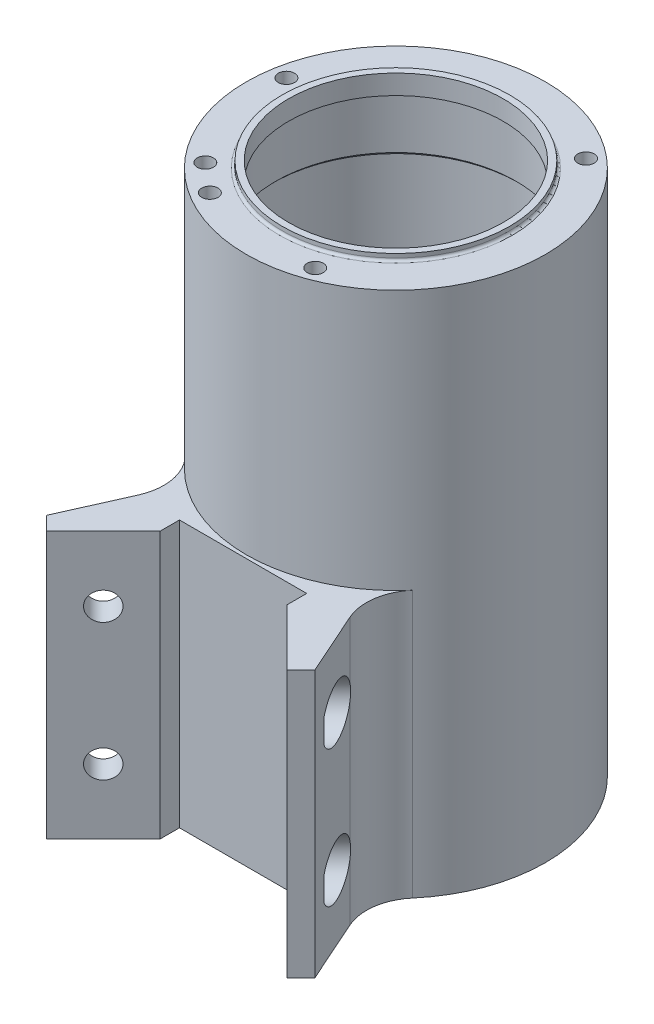
from build123d import *

# Parameters (mm, degrees)
BOSS_EXTRUDE1_START           = -40
BOSS_EXTRUDE1_DEPTH           = 41
SKETCH7_W                     = 1.6
SKETCH7_H                     = 83.5
M3_CLEARANCE_HOLE1_AT_2_COUNT = 2
M3_CLEARANCE_HOLE1_AT_2_PITCH = 20.75
M3_CLEARANCE_HOLE1_AT_3_COUNT = 2
M3_CLEARANCE_HOLE1_AT_3_PITCH = 35.940054257
M3_CLEARANCE_HOLE1_AT_4_COUNT = 2
M3_CLEARANCE_HOLE1_AT_4_PITCH = 41.5
M3_CLEARANCE_HOLE1_AT_5_COUNT = 2
M3_CLEARANCE_HOLE1_AT_5_PITCH = 35.940054257
M3_CLEARANCE_HOLE1_AT_6_COUNT = 2
M3_CLEARANCE_HOLE1_AT_6_PITCH = 20.75
M3_TAPPED_HOLE2_AT_2_COUNT    = 2
M3_TAPPED_HOLE2_AT_2_PITCH    = 20.75
M3_TAPPED_HOLE2_AT_3_COUNT    = 2
M3_TAPPED_HOLE2_AT_3_PITCH    = 35.940054257
M3_TAPPED_HOLE2_AT_4_COUNT    = 2
M3_TAPPED_HOLE2_AT_4_PITCH    = 41.5
M3_TAPPED_HOLE2_AT_5_COUNT    = 2
M3_TAPPED_HOLE2_AT_5_PITCH    = 35.940054257
M3_TAPPED_HOLE2_AT_6_COUNT    = 2
M3_TAPPED_HOLE2_AT_6_PITCH    = 20.75
M3_TAPPED_HOLE1_AT_2_COUNT    = 2
M3_TAPPED_HOLE1_AT_2_PITCH    = 35.940054257
M3_TAPPED_HOLE1_AT_3_COUNT    = 2
M3_TAPPED_HOLE1_AT_3_PITCH    = 35.940054257
M3_TAPPED_HOLE1_AT_4_COUNT    = 2
M3_TAPPED_HOLE1_AT_4_PITCH    = 41.401555851
M3_TAPPED_HOLE1_AT_5_COUNT    = 2
M3_TAPPED_HOLE1_AT_5_PITCH    = 41.401555851
FILLET1_R                     = 8
BOSS_EXTRUDE2_START           = 1
SKETCH18_R                    = 17.5
SKETCH18_R_2                  = 16.5
BOSS_EXTRUDE2_DEPTH           = 1
ADVANCEDHOLE1_START           = -7.819805153
ADVANCEDHOLE1_DEPTH           = 2.897488682
ADVANCEDHOLE1_START_2         = -11.819805153
ADVANCEDHOLE1_2_OUTLINE_R     = 2.15
ADVANCEDHOLE1_2_DEPTH         = 4
ADVANCEDHOLE2_START           = 4.922316471
ADVANCEDHOLE2_DEPTH           = 2.897488682
ADVANCEDHOLE2_START_2         = 7.819805153
ADVANCEDHOLE2_2_OUTLINE_R     = 2.15
ADVANCEDHOLE2_2_DEPTH         = 4
FILLET2_R                     = 0.4
FILLET4_R                     = 0.15
CHAMFER1_SIZE                 = 0.5
CHAMFER2_SIZE                 = 0.6
FILLET5_R                     = 0.4


with BuildPart() as part:
    # Sketch2 → Revolve1 (revolve)
    with BuildSketch(Plane(origin=(0, 0, 0), x_dir=(0, 0, -1), z_dir=(1, 0, 0)), mode=Mode.PRIVATE) as revolve1_sk:
        Polygon((18.5, -83.5), (18.5, -74.5), (19, -74.5), (19, -14.5), (18.5, -14.5), (18.5, -5.5), (16.5, -5.5), (16.5, -3.5), (23, -3.5), (23, -84.5), (18.5, -84.5), align=None)
    revolve(revolve1_sk.sketch.rotate(Axis((0, 55, 0), (0, -1, 0)), 180), axis=Axis((0, 55, 0), (0, -1, 0)))

    # Sketch3 → Boss-Extrude1 (add, through all)
    with BuildSketch(Plane(origin=(0, -3.5, 0), x_dir=(1, 0, 0), z_dir=(0, 1, 0)).offset(BOSS_EXTRUDE1_START)):
        with BuildLine():
            Line((-18.5, -35.215728753), (-20.621320344, -33.094408409))
            Line((-20.621320344, -33.094408409), (-14, -18.248287591))
            ThreePointArc((-14, -18.248287591), (0, -23), (14, -18.248287591))
            Line((14, -18.248287591), (20.621320344, -33.094408409))
            Line((20.621320344, -33.094408409), (18.5, -35.215728753))
            Line((18.5, -35.215728753), (9.784271247, -26.5))
            Line((9.784271247, -26.5), (9.784271247, -23.5))
            Line((9.784271247, -23.5), (-9.784271247, -23.5))
            Line((-9.784271247, -23.5), (-9.784271247, -26.5))
            Line((-9.784271247, -26.5), (-18.5, -35.215728753))
        make_face()
    extrude(amount=-BOSS_EXTRUDE1_DEPTH)

    # Sketch10 → M3 Tapped Hole2 (revolve, cut)
    with BuildSketch(Plane(origin=(0, -84.5, -20.75), x_dir=(0, 0, -1), z_dir=(1, 0, 0))):
        Polygon((0, 0), (0, 9.251075774), (1.25, 8.5), (1.25, 0), align=None)
    m3_tapped_hole2 = revolve(axis=Axis((0, -90.85, -20.75), (0, 1, 0)), mode=Mode.SUBTRACT)

    # M3 Tapped Hole2 at 2: M3 Tapped Hole2 ×2
    with Locations(*[Vector(-0.8660254037844387, 0, 0.4999999999999999) * (i * M3_TAPPED_HOLE2_AT_2_PITCH) for i in range(1, M3_TAPPED_HOLE2_AT_2_COUNT)]):
        add(m3_tapped_hole2, mode=Mode.SUBTRACT)

    # M3 Tapped Hole2 at 3: M3 Tapped Hole2 ×2
    with Locations(*[Vector(-0.5000000000000002, 0, 0.8660254037844386) * (i * M3_TAPPED_HOLE2_AT_3_PITCH) for i in range(1, M3_TAPPED_HOLE2_AT_3_COUNT)]):
        add(m3_tapped_hole2, mode=Mode.SUBTRACT)

    # M3 Tapped Hole2 at 4: M3 Tapped Hole2 ×2
    with Locations(*[(0, 0, i * M3_TAPPED_HOLE2_AT_4_PITCH) for i in range(1, M3_TAPPED_HOLE2_AT_4_COUNT)]):
        add(m3_tapped_hole2, mode=Mode.SUBTRACT)

    # M3 Tapped Hole2 at 5: M3 Tapped Hole2 ×2
    with Locations(*[Vector(0.49999999999999983, 0, 0.8660254037844388) * (i * M3_TAPPED_HOLE2_AT_5_PITCH) for i in range(1, M3_TAPPED_HOLE2_AT_5_COUNT)]):
        add(m3_tapped_hole2, mode=Mode.SUBTRACT)

    # M3 Tapped Hole2 at 6: M3 Tapped Hole2 ×2
    with Locations(*[Vector(0.8660254037844387, 0, 0.49999999999999983) * (i * M3_TAPPED_HOLE2_AT_6_PITCH) for i in range(1, M3_TAPPED_HOLE2_AT_6_COUNT)]):
        add(m3_tapped_hole2, mode=Mode.SUBTRACT)

    # Sketch15 → M3 Tapped Hole1 (revolve, cut)
    with BuildSketch(Plane(origin=(13.337842901, -3.5, -15.895422195), x_dir=(0, 0, 1), z_dir=(1, 0, 0))):
        Polygon((0, 0), (0, 8.251075774), (1.25, 7.5), (1.25, 0), align=None)
    m3_tapped_hole1 = revolve(axis=Axis((13.337842901, 2.85, -15.895422195), (0, -1, 0)), mode=Mode.SUBTRACT)

    # M3 Tapped Hole1 at 2: M3 Tapped Hole1 ×2
    with Locations(*[Vector(-0.1736481776669317, 0, 0.9848077530122079) * (i * M3_TAPPED_HOLE1_AT_2_PITCH) for i in range(1, M3_TAPPED_HOLE1_AT_2_COUNT)]):
        add(m3_tapped_hole1, mode=Mode.SUBTRACT)

    # M3 Tapped Hole1 at 3: M3 Tapped Hole1 ×2
    with Locations(*[Vector(-0.9396926207859091, 0, 0.34202014332566705) * (i * M3_TAPPED_HOLE1_AT_3_PITCH) for i in range(1, M3_TAPPED_HOLE1_AT_3_COUNT)]):
        add(m3_tapped_hole1, mode=Mode.SUBTRACT)

    # M3 Tapped Hole1 at 4: M3 Tapped Hole1 ×2
    with Locations(*[Vector(-0.6939957840318893, 0, 0.7199790634080712) * (i * M3_TAPPED_HOLE1_AT_4_PITCH) for i in range(1, M3_TAPPED_HOLE1_AT_4_COUNT)]):
        add(m3_tapped_hole1, mode=Mode.SUBTRACT)

    # M3 Tapped Hole1 at 5: M3 Tapped Hole1 ×2
    with Locations(*[Vector(-0.5885298604450689, 0, 0.8084754809915435) * (i * M3_TAPPED_HOLE1_AT_5_PITCH) for i in range(1, M3_TAPPED_HOLE1_AT_5_COUNT)]):
        add(m3_tapped_hole1, mode=Mode.SUBTRACT)

    # Fillet1
    fillet1_edges = [part.edges().sort_by_distance(p)[0] for p in [
        (-14, -64, 18.248287591),
        (14, -64, 18.248287591),
    ]]
    fillet(fillet1_edges, radius=FILLET1_R)

    # Sketch18 → Boss-Extrude2 (add)
    with BuildSketch(Plane(origin=(0, -3.5, 0), x_dir=(1, 0, 0), z_dir=(0, 1, 0)).offset(BOSS_EXTRUDE2_START)):
        with Locations(Location((0, 0, 0), (0, 0, 90))):
            Circle(SKETCH18_R)
        with Locations(Location((0, 0, 0), (0, 0, 270))):
            Circle(SKETCH18_R_2, mode=Mode.SUBTRACT)
    extrude(amount=-BOSS_EXTRUDE2_DEPTH)

    # AdvancedHole1: read off the stored shape, not the designer's step
    # AdvancedHole1 outline → AdvancedHole1 (cut)
    with BuildSketch(Plane(origin=(0, 0, 0), x_dir=(0.707106781186546, 0, 0.707106781186549), z_dir=(0.707106781186549, 0, -0.707106781186546)).offset(ADVANCEDHOLE1_START)):
        with BuildLine():
            ThreePointArc((35.372669499, 76.337703714), (27.819805153, 74.5), (35.372669499, 72.662296286))
            Line((35.372669499, 72.662296286), (36.323213796, 74.5))
            Line((36.323213796, 74.5), (35.372669499, 76.337703714))
        make_face()
        with BuildLine():
            Line((35.372669499, 51.662296286), (36.323213796, 53.5))
            Line((36.323213796, 53.5), (35.372669499, 55.337703714))
            ThreePointArc((35.372669499, 55.337703714), (27.819805153, 53.5), (35.372669499, 51.662296286))
        make_face()
    extrude(amount=ADVANCEDHOLE1_DEPTH, mode=Mode.SUBTRACT)

    # AdvancedHole1 2 outline → AdvancedHole1 2 (cut)
    with BuildSketch(Plane(origin=(0, 0, 0), x_dir=(0.707106781186546, 0, 0.707106781186549), z_dir=(0.707106781186549, 0, -0.707106781186546)).offset(ADVANCEDHOLE1_START_2)):
        with Locations((31.819805153, 74.5)):
            Circle(ADVANCEDHOLE1_2_OUTLINE_R)
        with Locations((31.819805153, 53.5)):
            Circle(ADVANCEDHOLE1_2_OUTLINE_R)
    extrude(amount=ADVANCEDHOLE1_2_DEPTH, mode=Mode.SUBTRACT)

    # AdvancedHole2: read off the stored shape, not the designer's step
    # AdvancedHole2 outline → AdvancedHole2 (cut)
    with BuildSketch(Plane(origin=(0, 0, 0), x_dir=(0.707106781186546, 0, -0.707106781186549), z_dir=(0.707106781186549, 0, 0.707106781186546)).offset(ADVANCEDHOLE2_START)):
        with BuildLine():
            Line((-36.323213796, -74.5), (-35.372669499, -76.337703714))
            ThreePointArc((-35.372669499, -76.337703714), (-27.819805153, -74.5), (-35.372669499, -72.662296286))
            Line((-35.372669499, -72.662296286), (-36.323213796, -74.5))
        make_face()
        with BuildLine():
            Line((-35.372669499, -51.662296286), (-36.323213796, -53.5))
            Line((-36.323213796, -53.5), (-35.372669499, -55.337703714))
            ThreePointArc((-35.372669499, -55.337703714), (-27.819805153, -53.5), (-35.372669499, -51.662296286))
        make_face()
    extrude(amount=ADVANCEDHOLE2_DEPTH, mode=Mode.SUBTRACT)

    # AdvancedHole2 2 outline → AdvancedHole2 2 (cut)
    with BuildSketch(Plane(origin=(0, 0, 0), x_dir=(0.707106781186546, 0, -0.707106781186549), z_dir=(0.707106781186549, 0, 0.707106781186546)).offset(ADVANCEDHOLE2_START_2)):
        with Locations((-31.819805153, -74.5)):
            Circle(ADVANCEDHOLE2_2_OUTLINE_R)
        with Locations((-31.819805153, -53.5)):
            Circle(ADVANCEDHOLE2_2_OUTLINE_R)
    extrude(amount=ADVANCEDHOLE2_2_DEPTH, mode=Mode.SUBTRACT)

    # Fillet2
    fillet2_edges = [part.edges().sort_by_distance(p)[0] for p in [
        (0, -3.5, 17.5),
    ]]
    fillet(fillet2_edges, radius=FILLET2_R)

    # Fillet4
    fillet4_edges = [part.edges().sort_by_distance(p)[0] for p in [
        (0, -5.5, -18.5),
    ]]
    fillet(fillet4_edges, radius=FILLET4_R)

    # Chamfer1
    chamfer1_edges = [part.edges().sort_by_distance(p)[0] for p in [
        (0, -14.5, -19),
        (0, -74.5, -19),
    ]]
    chamfer(chamfer1_edges, length=CHAMFER1_SIZE - 0.0001)  # a hair under: the kernel refuses the full size

    # Chamfer2
    chamfer2_edges = [part.edges().sort_by_distance(p)[0] for p in [
        (0, -84.5, -18.5),
    ]]
    chamfer(chamfer2_edges, length=CHAMFER2_SIZE)


with BuildPart() as body_2:
    # Sketch5 → Revolve2 (revolve)
    with BuildSketch(Plane(origin=(0, 0, 0), x_dir=(0, 0, -1), z_dir=(1, 0, 0)), mode=Mode.PRIVATE) as revolve2_sk:
        Polygon((18.5, -83.5), (16.5, -83.5), (16.5, -87), (23, -87), (23, -85), (18.5, -85), align=None)
    revolve(revolve2_sk.sketch.rotate(Axis((0, 55, 0), (0, -1, 0)), 180), axis=Axis((0, 55, 0), (0, -1, 0)))

    # Sketch7 → M3 Clearance Hole1 (revolve, cut)
    with BuildSketch(Plane(origin=(17.970027129, -87, -10.375), x_dir=(0, 0, -1), z_dir=(1, 0, 0))):
        with Locations((0.8, 41.75)):
            Rectangle(SKETCH7_W, SKETCH7_H)
    m3_clearance_hole1 = revolve(axis=Axis((17.970027129, -93.35, -10.375), (0, 1, 0)), mode=Mode.SUBTRACT)

    # M3 Clearance Hole1 at 2: M3 Clearance Hole1 ×2
    with Locations(*[Vector(-0.8660254037844387, 0, -0.49999999999999983) * (i * M3_CLEARANCE_HOLE1_AT_2_PITCH) for i in range(1, M3_CLEARANCE_HOLE1_AT_2_COUNT)]):
        add(m3_clearance_hole1, mode=Mode.SUBTRACT)

    # M3 Clearance Hole1 at 3: M3 Clearance Hole1 ×2
    with Locations(*[(-i * M3_CLEARANCE_HOLE1_AT_3_PITCH, 0, 0) for i in range(1, M3_CLEARANCE_HOLE1_AT_3_COUNT)]):
        add(m3_clearance_hole1, mode=Mode.SUBTRACT)

    # M3 Clearance Hole1 at 4: M3 Clearance Hole1 ×2
    with Locations(*[Vector(-0.8660254037844387, 0, 0.5) * (i * M3_CLEARANCE_HOLE1_AT_4_PITCH) for i in range(1, M3_CLEARANCE_HOLE1_AT_4_COUNT)]):
        add(m3_clearance_hole1, mode=Mode.SUBTRACT)

    # M3 Clearance Hole1 at 5: M3 Clearance Hole1 ×2
    with Locations(*[Vector(-0.5000000000000001, 0, 0.8660254037844387) * (i * M3_CLEARANCE_HOLE1_AT_5_PITCH) for i in range(1, M3_CLEARANCE_HOLE1_AT_5_COUNT)]):
        add(m3_clearance_hole1, mode=Mode.SUBTRACT)

    # M3 Clearance Hole1 at 6: M3 Clearance Hole1 ×2
    with Locations(*[(0, 0, i * M3_CLEARANCE_HOLE1_AT_6_PITCH) for i in range(1, M3_CLEARANCE_HOLE1_AT_6_COUNT)]):
        add(m3_clearance_hole1, mode=Mode.SUBTRACT)

    # Fillet5
    fillet5_edges = [body_2.edges().sort_by_distance(p)[0] for p in [
        (0, -85, -18.5),
    ]]
    fillet(fillet5_edges, radius=FILLET5_R)


solid = part.part
